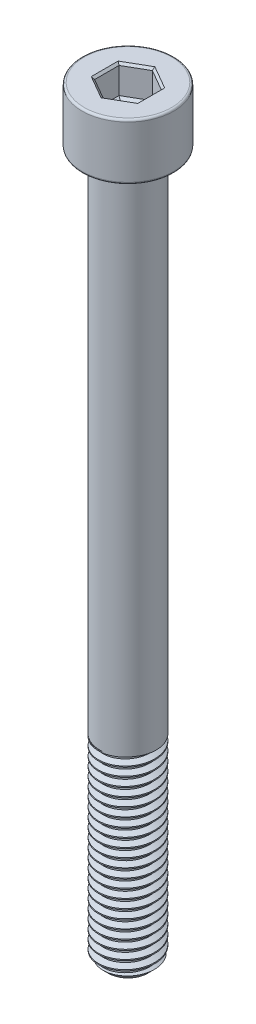
from build123d import *

# Parameters (mm, degrees)
SKETCH1_R           = 4
BOSS_EXTRUDE1_DEPTH = 28
THREAD1_PITCH       = 1.25
SKETCH2_R           = 4
BOSS_EXTRUDE2_DEPTH = 72
SKETCH5_R           = 6.5
BOSS_EXTRUDE3_DEPTH = 8
FILLET1_R           = 0.3
CUT_EXTRUDE1_DEPTH  = 4
CHAMFER1_SIZE       = 0.3
CUT_EXTRUDE2_DEPTH  = 0.4
CUT_EXTRUDE2_DRAFT  = -60


with BuildPart() as part:
    # Sketch1 → Boss-Extrude1 (new body)
    with BuildSketch(Plane(origin=(0, 0, 0), x_dir=(1, 0, 0), z_dir=(0, 1, 0))):
        with Locations(Location((0, 0, 0), (0, 0, 270))):
            Circle(SKETCH1_R)
    extrude(amount=BOSS_EXTRUDE1_DEPTH)

    # Thread1: the profile of Thread Profile1 profile screwed along a right-hand helix of 24 turns, 8 arcs to a turn; built about Z, then put on its axis
    thread1_z = Axis((0, 0, 0), (0, 0, 1))
    thread1_corners = [(4.0003, 0, -0.000173205), (4.0003, 0, 1.093923202), (3.323417656, 0, 0.703124998), (3.323417656, 0, 0.390624998)]
    with BuildLine(mode=Mode.PRIVATE) as thread1_profile:
        Line(thread1_corners[0], thread1_corners[1])
        Line(thread1_corners[1], thread1_corners[2])
        Line(thread1_corners[2], thread1_corners[3])
        Line(thread1_corners[3], thread1_corners[0])
    thread1_cap = Face(thread1_profile.wire())
    thread1_turn_angles = [0, 22.5, 45, 67.5, 90, 112.5, 135, 157.5, 180, 202.5, 225, 247.5, 270, 292.5, 315, 337.5, 360]
    thread1_turn_weights = [1, 0.9238795325112867, 1, 0.9238795325112867, 1, 0.9238795325112867, 1, 0.9238795325112867, 1, 0.9238795325112867, 1, 0.9238795325112867, 1, 0.9238795325112867, 1, 0.9238795325112867, 1]
    thread1_turn_rails = [Edge.make_bspline([Vector(p[0], p[1], 0).rotate(thread1_z, thread1_turn_angles[k]) / thread1_turn_weights[k] + Vector(0, 0, p[2] + THREAD1_PITCH * thread1_turn_angles[k] / 360) for k in range(17)], [0, 0, 0, 1, 1, 2, 2, 3, 3, 4, 4, 5, 5, 6, 6, 7, 7, 8, 8, 8], 2, thread1_turn_weights) for p in thread1_corners]
    thread1_turn_sides = [Face.make_surface_from_curves(thread1_turn_rails[p[0]], thread1_turn_rails[p[1]]) for p in [(0, 1), (1, 2), (2, 3), (3, 0)]]
    thread1 = Plane(origin=(0, 30, 0), x_dir=(-1, 0, 0), z_dir=(0, -1, 0)) * Solid(Shell([*[p.moved(Location((0, 0, THREAD1_PITCH * i))) for i in range(24) for p in thread1_turn_sides], thread1_cap, thread1_cap.rotate(thread1_z, 8640).moved(Location((0, 0, THREAD1_PITCH * 8640 / 360)))]))
    add(thread1, mode=Mode.SUBTRACT)

    # Sketch2 → Boss-Extrude2 (add)
    with BuildSketch(Plane(origin=(0, 28, 0), x_dir=(1, 0, 0), z_dir=(0, 1, 0))):
        with Locations(Location((0, 0, 0), (0, 0, 117.593571361))):
            Circle(SKETCH2_R)
    extrude(amount=BOSS_EXTRUDE2_DEPTH)

    # Sketch5 → Boss-Extrude3 (add)
    with BuildSketch(Plane(origin=(0, 100, 0), x_dir=(1, 0, 0), z_dir=(0, 1, 0))):
        with Locations(Location((0, 0, 0), (0, 0, 270))):
            Circle(SKETCH5_R)
    extrude(amount=BOSS_EXTRUDE3_DEPTH)

    # Sketch6 → Cut-Revolve1 (revolve, cut)
    with BuildSketch(Plane.XY, mode=Mode.PRIVATE) as cut_revolve1_sk:
        Polygon((4.01, 0), (4.01, 1.2), (2.81, 0), align=None)
    revolve(cut_revolve1_sk.sketch.rotate(Axis((0, 0, 0), (0, 1, 0)), 117.593571361), axis=Axis((0, 0, 0), (0, 1, 0)), mode=Mode.SUBTRACT)

    # Fillet1
    fillet1_edges = [part.edges().sort_by_distance(p)[0] for p in [
        (0, 100, -6.5),
        (0, 108, -6.5),
    ]]
    fillet(fillet1_edges, radius=FILLET1_R)

    # Sketch7 → Cut-Extrude1 (cut)
    with BuildSketch(Plane(origin=(0, 108, 0), x_dir=(1, 0, 0), z_dir=(0, 1, 0))):
        Polygon((0, 3.464101615), (-3, 1.732050808), (-3, -1.732050808), (0, -3.464101615), (3, -1.732050808), (3, 1.732050808), align=None)
    extrude(amount=-CUT_EXTRUDE1_DEPTH, mode=Mode.SUBTRACT)

    # Chamfer1
    chamfer1_edges = [part.edges().sort_by_distance(p)[0] for p in [
        (1.5, 108, -2.598076211),
        (-1.5, 108, -2.598076211),
        (-3, 108, 0),
        (-1.5, 108, 2.598076211),
        (1.5, 108, 2.598076211),
        (3, 108, 0),
    ]]
    chamfer(chamfer1_edges, length=CHAMFER1_SIZE)


with BuildPart() as cut_extrude2_tool:
    # Sketch8 → Cut-Extrude2 (with draft: the straight prism first)
    with BuildSketch(Plane(origin=(0, 104, 0), x_dir=(1, 0, 0), z_dir=(0, 1, 0))):
        Polygon((0, 3.464101615), (-3, 1.732050808), (-3, -1.732050808), (0, -3.464101615), (3, -1.732050808), (3, 1.732050808), align=None)
    extrude(amount=-CUT_EXTRUDE2_DEPTH)
    # Cut-Extrude2: the draft: its side faces are tilted about the plane it starts from
    cut_extrude2_sides = [cut_extrude2_tool.faces().sort_by_distance(p)[0] for p in [
        (-1.5, 103.8, -2.598076211),
        (-3, 103.8, 0),
        (-1.5, 103.8, 2.598076211),
        (1.5, 103.8, 2.598076211),
        (3, 103.8, 0),
        (1.5, 103.8, -2.598076211),
    ]]
    draft(cut_extrude2_sides, Plane(origin=(0, 104, 0), x_dir=(1, 0, 0), z_dir=(0, 1, 0)), CUT_EXTRUDE2_DRAFT)


with BuildPart() as part_1:
    add(part.part)

    # Cut-Extrude2: cut by cut_extrude2_tool
    add(cut_extrude2_tool.part, mode=Mode.SUBTRACT)


solid = part_1.part
